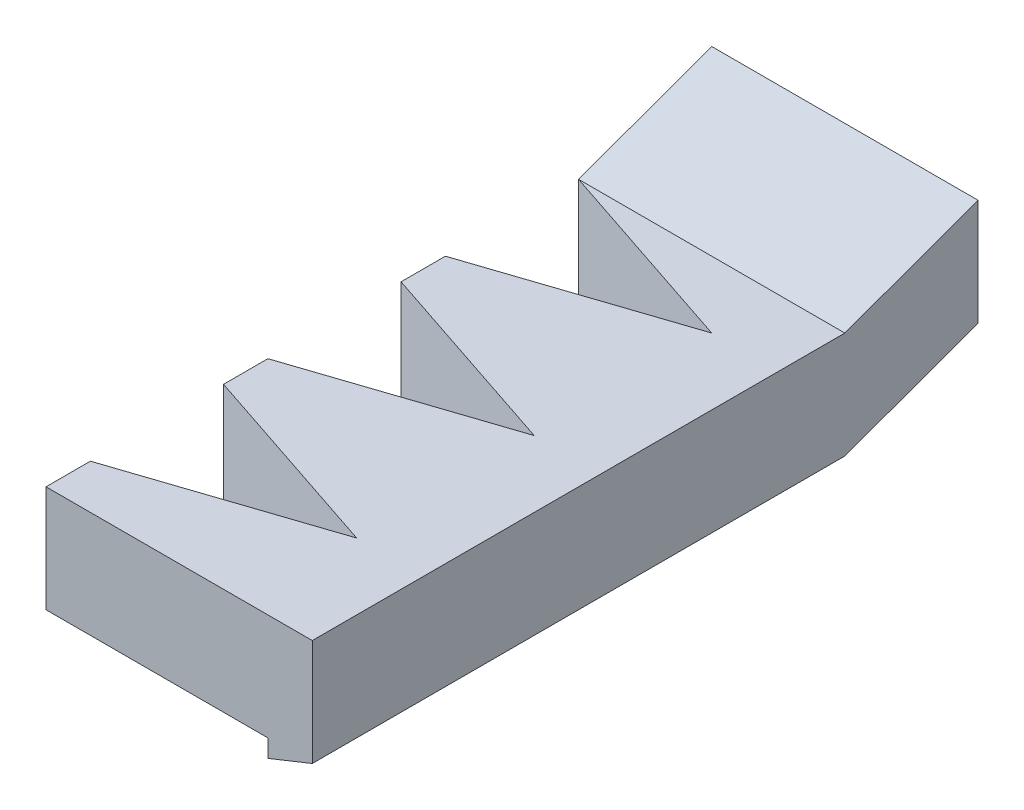
from build123d import *

# Parameters (mm, degrees)
SKETCH1_W           = 30
SKETCH1_H           = 75
BOSS_EXTRUDE1_DEPTH = 12
CUT_EXTRUDE1_DEPTH  = 12
LPATTERN1_COUNT     = 3
LPATTERN1_PITCH     = 20
CUT_EXTRUDE2_DEPTH  = 30
BOSS_EXTRUDE2_DEPTH = 30
BOUNDARY1_START     = -45
BOUNDARY1_DEPTH     = 5
LPATTERN2_COUNT     = 3
LPATTERN2_PITCH     = 20


# Read off the part's stored shape, not the designer's step: Boundary1
with BuildPart() as part:
    # Sketch1 → Boss-Extrude1 (new body)
    with BuildSketch(Plane(origin=(0, 0, 0), x_dir=(1, 0, 0), z_dir=(0, 1, 0))):
        with Locations((15, 37.5)):
            Rectangle(SKETCH1_W, SKETCH1_H)
    extrude(amount=BOSS_EXTRUDE1_DEPTH)

    # Sketch3 → Cut-Extrude1 (cut)
    with BuildSketch(Plane(origin=(0, 0, 0), x_dir=(1, 0, 0), z_dir=(0, 1, 0))):
        Polygon((0, 5), (22.5, 12.5), (0, 20), align=None)
    cut_extrude1 = extrude(amount=CUT_EXTRUDE1_DEPTH, mode=Mode.SUBTRACT)

    # LPattern1: Cut-Extrude1 ×3
    with Locations(*[(0, 0, -i * LPATTERN1_PITCH) for i in range(1, LPATTERN1_COUNT)]):
        add(cut_extrude1, mode=Mode.SUBTRACT)

    # Sketch6 → Cut-Extrude2 (cut)
    with BuildSketch(Plane(origin=(0, 0, 0), x_dir=(0, 0, -1), z_dir=(1, 0, 0))):
        Polygon((60, 0), (75, 0), (75, 5.459553514), align=None)
    extrude(amount=CUT_EXTRUDE2_DEPTH, mode=Mode.SUBTRACT)

    # Sketch12 → Boss-Extrude2 (add)
    with BuildSketch(Plane.ZY):
        Polygon((-60, 12), (-75, 12), (-75, 17.459553514), align=None)
    extrude(amount=-BOSS_EXTRUDE2_DEPTH)

    # Boundary1 outline → Boundary1 (add)
    with BuildSketch(Plane.XY.offset(BOUNDARY1_START)):
        Polygon((25, 0), (25, -2), (30, 0), align=None)
    boundary1 = extrude(amount=BOUNDARY1_DEPTH)

    # LPattern2: Boundary1 ×3
    with Locations(*[(0, 0, i * LPATTERN2_PITCH) for i in range(1, LPATTERN2_COUNT)]):
        add(boundary1)


solid = part.part
